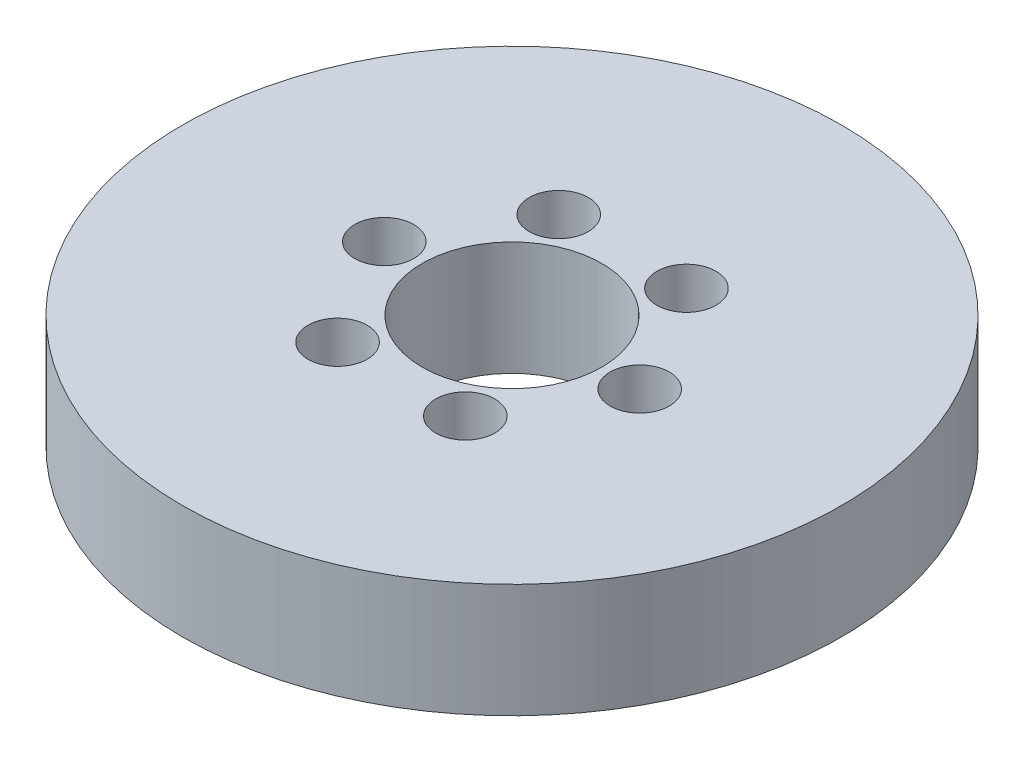
from build123d import *

# Parameters (mm, degrees)
SKETCH1_R           = 55
BOSS_EXTRUDE1_DEPTH = 19
SKETCH2_R           = 15
CUT_EXTRUDE1_DEPTH  = 81.068720484
SKETCH3_R           = 4.934066531
CUT_EXTRUDE2_DEPTH  = 16.20044714
CIRPATTERN1_COUNT   = 6


with BuildPart() as part:
    # Sketch1 → Boss-Extrude1 (new body)
    with BuildSketch(Plane(origin=(0, 0, 0), x_dir=(1, 0, 0), z_dir=(0, 1, 0))):
        Circle(SKETCH1_R)
    extrude(amount=BOSS_EXTRUDE1_DEPTH)

    # Sketch2 → Cut-Extrude1 (cut, through all)
    with BuildSketch(Plane(origin=(0, 0, 0), x_dir=(1, 0, 0), z_dir=(0, 1, 0))):
        Circle(SKETCH2_R)
    extrude(amount=CUT_EXTRUDE1_DEPTH, mode=Mode.SUBTRACT)

    # Sketch3 → Cut-Extrude2 (cut)
    with BuildSketch(Plane(origin=(0, 19, 0), x_dir=(1, 0, 0), z_dir=(0, 1, 0))):
        with Locations((-21.313221427, 0)):
            Circle(SKETCH3_R)
    cut_extrude2 = extrude(amount=-CUT_EXTRUDE2_DEPTH, mode=Mode.SUBTRACT)

    # CirPattern1: Cut-Extrude2 ×6 about axis
    cirpattern1_axis = Axis((0, 0, 0), (0, 1, 0))
    for i in range(1, CIRPATTERN1_COUNT):
        add(cut_extrude2.rotate(cirpattern1_axis, i * 360 / CIRPATTERN1_COUNT), mode=Mode.SUBTRACT)


solid = part.part
